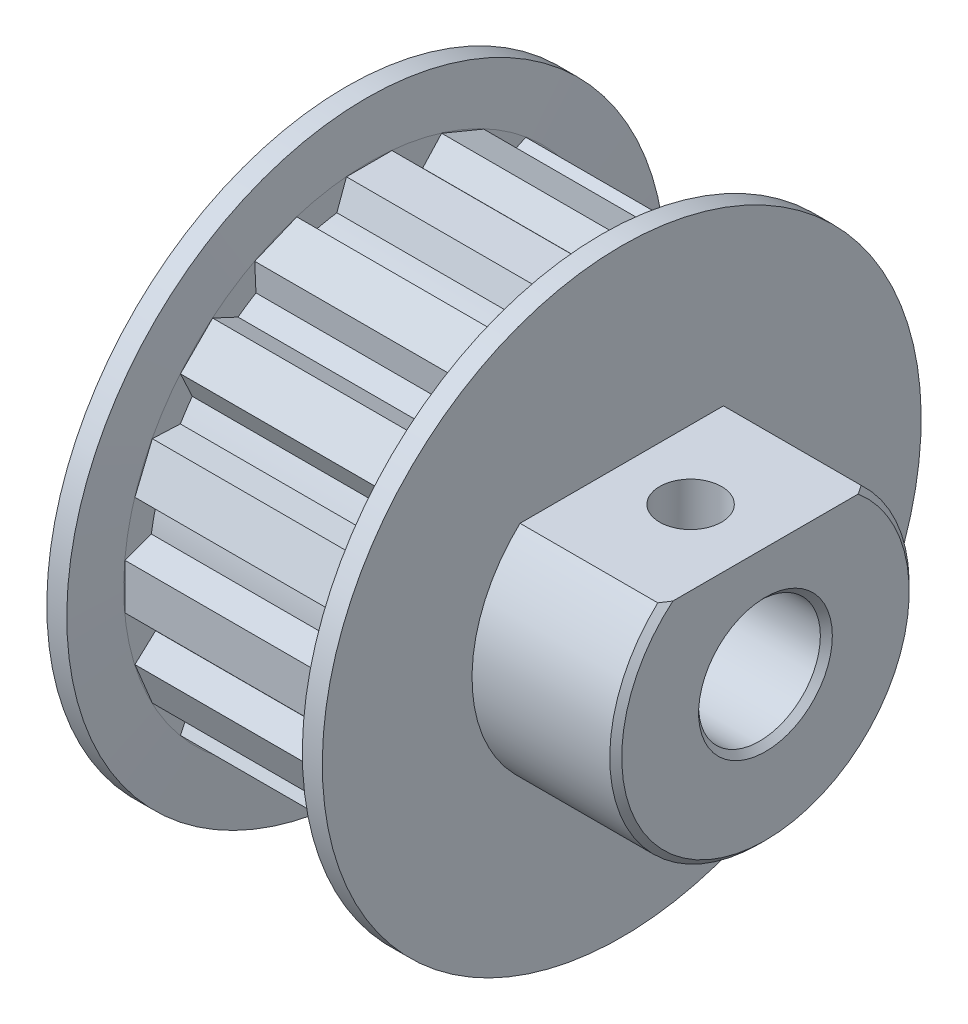
from build123d import *

# Parameters (mm, degrees)
SKETCH2_R                = 7.5
BOSS_EXTRUDE1_DEPTH      = 7.2
F_6_0_6_DIAMETER_HOLE1_D = 6.1
RIB1_REACH               = 31.85
SKETCH5_WALL_W           = 73.199246226
SKETCH5_WALL_H           = 2.28033022
RIB1_DRAFT_ANGLE         = 20
RIB2_REACH               = 31.85
SKETCH6_WALL_W           = 73.199246226
SKETCH6_WALL_H           = 2.28033022
RIB2_DRAFT_ANGLE         = 20
RIB3_REACH               = 31.85
SKETCH7_WALL_W           = 73.199246226
SKETCH7_WALL_H           = 2.28033022
RIB3_DRAFT_ANGLE         = 20
RIB4_REACH               = 31.85
SKETCH8_WALL_W           = 73.199246226
SKETCH8_WALL_H           = 2.28033022
RIB4_DRAFT_ANGLE         = 20
RIB5_REACH               = 31.85
SKETCH9_WALL_W           = 73.199246226
SKETCH9_WALL_H           = 2.28033022
RIB5_DRAFT_ANGLE         = 20
RIB6_REACH               = 31.85
SKETCH10_WALL_W          = 73.199246226
SKETCH10_WALL_H          = 2.28033022
RIB6_DRAFT_ANGLE         = 20
RIB7_REACH               = 31.85
SKETCH11_WALL_W          = 73.199246226
SKETCH11_WALL_H          = 2.28033022
RIB7_DRAFT_ANGLE         = 20
RIB8_REACH               = 31.85
SKETCH12_WALL_W          = 73.199246226
SKETCH12_WALL_H          = 2.28033022
RIB8_DRAFT_ANGLE         = 20
RIB9_REACH               = 31.85
SKETCH13_WALL_W          = 73.199246226
SKETCH13_WALL_H          = 2.28033022
RIB9_DRAFT_ANGLE         = 20
RIB10_REACH              = 31.85
SKETCH14_WALL_W          = 73.199246226
SKETCH14_WALL_H          = 2.28033022
RIB10_DRAFT_ANGLE        = 20
RIB11_REACH              = 31.85
SKETCH15_WALL_W          = 73.199246226
SKETCH15_WALL_H          = 2.28033022
RIB11_DRAFT_ANGLE        = 20
RIB12_REACH              = 31.85
SKETCH16_WALL_W          = 73.199246226
SKETCH16_WALL_H          = 2.28033022
RIB12_DRAFT_ANGLE        = 20
RIB13_REACH              = 31.85
SKETCH17_WALL_W          = 73.199246226
SKETCH17_WALL_H          = 2.28033022
RIB13_DRAFT_ANGLE        = 20
RIB14_REACH              = 31.85
SKETCH18_WALL_W          = 73.199246226
SKETCH18_WALL_H          = 2.28033022
RIB14_DRAFT_ANGLE        = 20
RIB15_REACH              = 31.85
SKETCH19_WALL_W          = 73.199246226
SKETCH19_WALL_H          = 2.28033022
RIB15_DRAFT_ANGLE        = 20
RIB16_REACH              = 31.85
SKETCH20_WALL_W          = 73.199246226
SKETCH20_WALL_H          = 2.28033022
RIB16_DRAFT_ANGLE        = 20
CHAMFER1_SIZE            = 0.3
SKETCH21_W               = 10.190038524
SKETCH21_H               = 2.367326759
CUT_EXTRUDE1_DEPTH       = 7.2
SKETCH22_R               = 1.55
CUT_EXTRUDE2_DEPTH       = 5.2


with BuildPart() as part:
    # Sketch1 → Revolve1 (revolve)
    with BuildSketch(Plane.XY):
        Polygon((0, 15), (0, 0), (13.8, 0), (13.8, 15), (12.8, 15), (12.65, 12.3), (12.65, 11.032395447), (1.15, 11.032395447), (1.15, 12.3), (1, 15), align=None)
    revolve(axis=Axis((0, 0, 0), (1, 0, 0)))

    # Sketch2 → Boss-Extrude1 (add)
    with BuildSketch(Plane(origin=(13.8, 0, 0), x_dir=(0, 0, -1), z_dir=(1, 0, 0))):
        Circle(SKETCH2_R)
    extrude(amount=BOSS_EXTRUDE1_DEPTH)

    # Ø6.0 (6) Diameter Hole1 (through all)
    with Locations(Plane(origin=(21, 0, 0), x_dir=(0, 0, -1), z_dir=(1, 0, 0))):
        with Locations((0, 0)):
            Hole(F_6_0_6_DIAMETER_HOLE1_D / 2)

    # Sketch5 wall → Rib1 (add, up to next)
    with BuildSketch(Plane(origin=(6.9, 0, 12.232395447), x_dir=(-1, 0, 0), z_dir=(0, 0, -1)), mode=Mode.PRIVATE) as rib1_sk1:
        Rectangle(SKETCH5_WALL_W, SKETCH5_WALL_H)
    rib1_tool1 = extrude(rib1_sk1.sketch, amount=RIB1_REACH, mode=Mode.PRIVATE) - part.part
    add(rib1_tool1.solids().sort_by_distance((6.9, 0, 12.232395447))[0])

    # Rib1 draft
    rib1_draft_faces = [part.faces().sort_by_distance(p)[0] for p in [
        (6.9, 1.14016511, 11.732395447),
        (6.9, -1.14016511, 11.732395447),
    ]]
    draft(rib1_draft_faces, Plane(origin=(6.9, 0, 12.232395447), x_dir=(-1, 0, 0), z_dir=(0, 0, 1)), RIB1_DRAFT_ANGLE)

    # Sketch6 wall → Rib2 (add, up to next)
    with BuildSketch(Plane(origin=(6.9, -12.232395447, 0), x_dir=(-1, 0, 0), z_dir=(0, 1, 0)), mode=Mode.PRIVATE) as rib2_sk1:
        Rectangle(SKETCH6_WALL_W, SKETCH6_WALL_H)
    rib2_tool1 = extrude(rib2_sk1.sketch, amount=RIB2_REACH, mode=Mode.PRIVATE) - part.part
    add(rib2_tool1.solids().sort_by_distance((6.9, -12.232395447, 0))[0])

    # Rib2 draft
    rib2_draft_faces = [part.faces().sort_by_distance(p)[0] for p in [
        (6.9, -11.732395447, 1.14016511),
        (6.9, -11.732395447, -1.14016511),
    ]]
    draft(rib2_draft_faces, Plane(origin=(6.9, -12.232395447, 0), x_dir=(-1, 0, 0), z_dir=(0, -1, 0)), RIB2_DRAFT_ANGLE)

    # Sketch7 wall → Rib3 (add, up to next)
    with BuildSketch(Plane(origin=(6.9, 0, -12.232395447), x_dir=(-1, 0, 0), z_dir=(0, 0, 1)), mode=Mode.PRIVATE) as rib3_sk1:
        Rectangle(SKETCH7_WALL_W, SKETCH7_WALL_H)
    rib3_tool1 = extrude(rib3_sk1.sketch, amount=RIB3_REACH, mode=Mode.PRIVATE) - part.part
    add(rib3_tool1.solids().sort_by_distance((6.9, 0, -12.232395447))[0])

    # Rib3 draft
    rib3_draft_faces = [part.faces().sort_by_distance(p)[0] for p in [
        (6.9, -1.14016511, -11.732395447),
        (6.9, 1.14016511, -11.732395447),
    ]]
    draft(rib3_draft_faces, Plane(origin=(6.9, 0, -12.232395447), x_dir=(-1, 0, 0), z_dir=(0, 0, -1)), RIB3_DRAFT_ANGLE)

    # Sketch8 wall → Rib4 (add, up to next)
    with BuildSketch(Plane(origin=(6.9, 12.232395447, 0), x_dir=(-1, 0, 0), z_dir=(0, -1, 0)), mode=Mode.PRIVATE) as rib4_sk1:
        Rectangle(SKETCH8_WALL_W, SKETCH8_WALL_H)
    rib4_tool1 = extrude(rib4_sk1.sketch, amount=RIB4_REACH, mode=Mode.PRIVATE) - part.part
    add(rib4_tool1.solids().sort_by_distance((6.9, 12.232395447, 0))[0])

    # Rib4 draft
    rib4_draft_faces = [part.faces().sort_by_distance(p)[0] for p in [
        (6.9, 11.732395447, -1.14016511),
        (6.9, 11.732395447, 1.14016511),
    ]]
    draft(rib4_draft_faces, Plane(origin=(6.9, 12.232395447, 0), x_dir=(-1, 0, 0), z_dir=(0, 1, 0)), RIB4_DRAFT_ANGLE)

    # Sketch9 wall → Rib5 (add, up to next)
    with BuildSketch(Plane(origin=(6.9, -4.681135076, 11.301259787), x_dir=(-1, 0, 0), z_dir=(0, 0.382683432365, -0.923879532511)), mode=Mode.PRIVATE) as rib5_sk1:
        Rectangle(SKETCH9_WALL_W, SKETCH9_WALL_H)
    rib5_tool1 = extrude(rib5_sk1.sketch, amount=RIB5_REACH, mode=Mode.PRIVATE) - part.part
    add(rib5_tool1.solids().sort_by_distance((6.9, -4.681135076, 11.301259787))[0])

    # Rib5 draft
    rib5_draft_faces = [part.faces().sort_by_distance(p)[0] for p in [
        (6.9, -3.436418151, 11.275642318),
        (6.9, -5.543168569, 10.402997723),
    ]]
    draft(rib5_draft_faces, Plane(origin=(6.9, -4.681135076, 11.301259787), x_dir=(-1, 0, 0), z_dir=(0, -0.382683432365, 0.923879532511)), RIB5_DRAFT_ANGLE)

    # Sketch10 wall → Rib6 (add, up to next)
    with BuildSketch(Plane(origin=(6.9, -4.681135076, -11.301259787), x_dir=(-1, 0, 0), z_dir=(0, 0.382683432365, 0.923879532511)), mode=Mode.PRIVATE) as rib6_sk1:
        Rectangle(SKETCH10_WALL_W, SKETCH10_WALL_H)
    rib6_tool1 = extrude(rib6_sk1.sketch, amount=RIB6_REACH, mode=Mode.PRIVATE) - part.part
    add(rib6_tool1.solids().sort_by_distance((6.9, -4.681135076, -11.301259787))[0])

    # Rib6 draft
    rib6_draft_faces = [part.faces().sort_by_distance(p)[0] for p in [
        (6.9, -5.543168569, -10.402997723),
        (6.9, -3.436418151, -11.275642318),
    ]]
    draft(rib6_draft_faces, Plane(origin=(6.9, -4.681135076, -11.301259787), x_dir=(-1, 0, 0), z_dir=(0, -0.382683432365, -0.923879532511)), RIB6_DRAFT_ANGLE)

    # Sketch11 wall → Rib7 (add, up to next)
    with BuildSketch(Plane(origin=(6.9, -11.301259787, 4.681135076), x_dir=(-1, 0, 0), z_dir=(0, 0.923879532511, -0.382683432365)), mode=Mode.PRIVATE) as rib7_sk1:
        Rectangle(SKETCH11_WALL_W, SKETCH11_WALL_H)
    rib7_tool1 = extrude(rib7_sk1.sketch, amount=RIB7_REACH, mode=Mode.PRIVATE) - part.part
    add(rib7_tool1.solids().sort_by_distance((6.9, -11.301259787, 4.681135076))[0])

    # Rib7 draft
    rib7_draft_faces = [part.faces().sort_by_distance(p)[0] for p in [
        (6.9, -10.402997723, 5.543168569),
        (6.9, -11.275642318, 3.436418151),
    ]]
    draft(rib7_draft_faces, Plane(origin=(6.9, -11.301259787, 4.681135076), x_dir=(-1, 0, 0), z_dir=(0, -0.923879532511, 0.382683432365)), RIB7_DRAFT_ANGLE)

    # Sketch12 wall → Rib8 (add, up to next)
    with BuildSketch(Plane(origin=(6.9, -8.649609771, -8.649609771), x_dir=(-1, 0, 0), z_dir=(0, 0.707106781187, 0.707106781187)), mode=Mode.PRIVATE) as rib8_sk1:
        Rectangle(SKETCH12_WALL_W, SKETCH12_WALL_H)
    rib8_tool1 = extrude(rib8_sk1.sketch, amount=RIB8_REACH, mode=Mode.PRIVATE) - part.part
    add(rib8_tool1.solids().sort_by_distance((6.9, -8.649609771, -8.649609771))[0])

    # Rib8 draft
    rib8_draft_faces = [part.faces().sort_by_distance(p)[0] for p in [
        (6.9, -9.102274861, -7.4898379),
        (6.9, -7.4898379, -9.102274861),
    ]]
    draft(rib8_draft_faces, Plane(origin=(6.9, -8.649609771, -8.649609771), x_dir=(-1, 0, 0), z_dir=(0, -0.707106781187, -0.707106781187)), RIB8_DRAFT_ANGLE)

    # Sketch13 wall → Rib9 (add, up to next)
    with BuildSketch(Plane(origin=(6.9, 8.649609771, 8.649609771), x_dir=(-1, 0, 0), z_dir=(0, -0.707106781187, -0.707106781187)), mode=Mode.PRIVATE) as rib9_sk1:
        Rectangle(SKETCH13_WALL_W, SKETCH13_WALL_H)
    rib9_tool1 = extrude(rib9_sk1.sketch, amount=RIB9_REACH, mode=Mode.PRIVATE) - part.part
    add(rib9_tool1.solids().sort_by_distance((6.9, 8.649609771, 8.649609771))[0])

    # Rib9 draft
    rib9_draft_faces = [part.faces().sort_by_distance(p)[0] for p in [
        (6.9, 9.102274861, 7.4898379),
        (6.9, 7.4898379, 9.102274861),
    ]]
    draft(rib9_draft_faces, Plane(origin=(6.9, 8.649609771, 8.649609771), x_dir=(-1, 0, 0), z_dir=(0, 0.707106781187, 0.707106781187)), RIB9_DRAFT_ANGLE)

    # Sketch14 wall → Rib10 (add, up to next)
    with BuildSketch(Plane(origin=(6.9, -11.301259787, -4.681135076), x_dir=(-1, 0, 0), z_dir=(0, 0.923879532511, 0.382683432365)), mode=Mode.PRIVATE) as rib10_sk1:
        Rectangle(SKETCH14_WALL_W, SKETCH14_WALL_H)
    rib10_tool1 = extrude(rib10_sk1.sketch, amount=RIB10_REACH, mode=Mode.PRIVATE) - part.part
    add(rib10_tool1.solids().sort_by_distance((6.9, -11.301259787, -4.681135076))[0])

    # Rib10 draft
    rib10_draft_faces = [part.faces().sort_by_distance(p)[0] for p in [
        (6.9, -11.275642318, -3.436418151),
        (6.9, -10.402997723, -5.543168569),
    ]]
    draft(rib10_draft_faces, Plane(origin=(6.9, -11.301259787, -4.681135076), x_dir=(-1, 0, 0), z_dir=(0, -0.923879532511, -0.382683432365)), RIB10_DRAFT_ANGLE)

    # Sketch15 wall → Rib11 (add, up to next)
    with BuildSketch(Plane(origin=(6.9, -8.649609771, 8.649609771), x_dir=(-1, 0, 0), z_dir=(0, 0.707106781187, -0.707106781187)), mode=Mode.PRIVATE) as rib11_sk1:
        Rectangle(SKETCH15_WALL_W, SKETCH15_WALL_H)
    rib11_tool1 = extrude(rib11_sk1.sketch, amount=RIB11_REACH, mode=Mode.PRIVATE) - part.part
    add(rib11_tool1.solids().sort_by_distance((6.9, -8.649609771, 8.649609771))[0])

    # Rib11 draft
    rib11_draft_faces = [part.faces().sort_by_distance(p)[0] for p in [
        (6.9, -7.4898379, 9.102274861),
        (6.9, -9.102274861, 7.4898379),
    ]]
    draft(rib11_draft_faces, Plane(origin=(6.9, -8.649609771, 8.649609771), x_dir=(-1, 0, 0), z_dir=(0, -0.707106781187, 0.707106781187)), RIB11_DRAFT_ANGLE)

    # Sketch16 wall → Rib12 (add, up to next)
    with BuildSketch(Plane(origin=(6.9, 8.649609771, -8.649609771), x_dir=(-1, 0, 0), z_dir=(0, -0.707106781187, 0.707106781187)), mode=Mode.PRIVATE) as rib12_sk1:
        Rectangle(SKETCH16_WALL_W, SKETCH16_WALL_H)
    rib12_tool1 = extrude(rib12_sk1.sketch, amount=RIB12_REACH, mode=Mode.PRIVATE) - part.part
    add(rib12_tool1.solids().sort_by_distance((6.9, 8.649609771, -8.649609771))[0])

    # Rib12 draft
    rib12_draft_faces = [part.faces().sort_by_distance(p)[0] for p in [
        (6.9, 7.4898379, -9.102274861),
        (6.9, 9.102274861, -7.4898379),
    ]]
    draft(rib12_draft_faces, Plane(origin=(6.9, 8.649609771, -8.649609771), x_dir=(-1, 0, 0), z_dir=(0, 0.707106781187, -0.707106781187)), RIB12_DRAFT_ANGLE)

    # Sketch17 wall → Rib13 (add, up to next)
    with BuildSketch(Plane(origin=(6.9, 4.681135076, -11.301259787), x_dir=(-1, 0, 0), z_dir=(0, -0.382683432365, 0.923879532511)), mode=Mode.PRIVATE) as rib13_sk1:
        Rectangle(SKETCH17_WALL_W, SKETCH17_WALL_H)
    rib13_tool1 = extrude(rib13_sk1.sketch, amount=RIB13_REACH, mode=Mode.PRIVATE) - part.part
    add(rib13_tool1.solids().sort_by_distance((6.9, 4.681135076, -11.301259787))[0])

    # Rib13 draft
    rib13_draft_faces = [part.faces().sort_by_distance(p)[0] for p in [
        (6.9, 3.436418151, -11.275642318),
        (6.9, 5.543168569, -10.402997723),
    ]]
    draft(rib13_draft_faces, Plane(origin=(6.9, 4.681135076, -11.301259787), x_dir=(-1, 0, 0), z_dir=(0, 0.382683432365, -0.923879532511)), RIB13_DRAFT_ANGLE)

    # Sketch18 wall → Rib14 (add, up to next)
    with BuildSketch(Plane(origin=(6.9, 11.301259787, 4.681135076), x_dir=(-1, 0, 0), z_dir=(0, -0.923879532511, -0.382683432365)), mode=Mode.PRIVATE) as rib14_sk1:
        Rectangle(SKETCH18_WALL_W, SKETCH18_WALL_H)
    rib14_tool1 = extrude(rib14_sk1.sketch, amount=RIB14_REACH, mode=Mode.PRIVATE) - part.part
    add(rib14_tool1.solids().sort_by_distance((6.9, 11.301259787, 4.681135076))[0])

    # Rib14 draft
    rib14_draft_faces = [part.faces().sort_by_distance(p)[0] for p in [
        (6.9, 11.275642318, 3.436418151),
        (6.9, 10.402997723, 5.543168569),
    ]]
    draft(rib14_draft_faces, Plane(origin=(6.9, 11.301259787, 4.681135076), x_dir=(-1, 0, 0), z_dir=(0, 0.923879532511, 0.382683432365)), RIB14_DRAFT_ANGLE)

    # Sketch19 wall → Rib15 (add, up to next)
    with BuildSketch(Plane(origin=(6.9, 11.301259787, -4.681135076), x_dir=(-1, 0, 0), z_dir=(0, -0.923879532511, 0.382683432365)), mode=Mode.PRIVATE) as rib15_sk1:
        Rectangle(SKETCH19_WALL_W, SKETCH19_WALL_H)
    rib15_tool1 = extrude(rib15_sk1.sketch, amount=RIB15_REACH, mode=Mode.PRIVATE) - part.part
    add(rib15_tool1.solids().sort_by_distance((6.9, 11.301259787, -4.681135076))[0])

    # Rib15 draft
    rib15_draft_faces = [part.faces().sort_by_distance(p)[0] for p in [
        (6.9, 10.402997723, -5.543168569),
        (6.9, 11.275642318, -3.436418151),
    ]]
    draft(rib15_draft_faces, Plane(origin=(6.9, 11.301259787, -4.681135076), x_dir=(-1, 0, 0), z_dir=(0, 0.923879532511, -0.382683432365)), RIB15_DRAFT_ANGLE)

    # Sketch20 wall → Rib16 (add, up to next)
    with BuildSketch(Plane(origin=(6.9, 4.681135076, 11.301259787), x_dir=(-1, 0, 0), z_dir=(0, -0.382683432365, -0.923879532511)), mode=Mode.PRIVATE) as rib16_sk1:
        Rectangle(SKETCH20_WALL_W, SKETCH20_WALL_H)
    rib16_tool1 = extrude(rib16_sk1.sketch, amount=RIB16_REACH, mode=Mode.PRIVATE) - part.part
    add(rib16_tool1.solids().sort_by_distance((6.9, 4.681135076, 11.301259787))[0])

    # Rib16 draft
    rib16_draft_faces = [part.faces().sort_by_distance(p)[0] for p in [
        (6.9, 5.543168569, 10.402997723),
        (6.9, 3.436418151, 11.275642318),
    ]]
    draft(rib16_draft_faces, Plane(origin=(6.9, 4.681135076, 11.301259787), x_dir=(-1, 0, 0), z_dir=(0, 0.382683432365, 0.923879532511)), RIB16_DRAFT_ANGLE)

    # Chamfer1
    chamfer1_edges = [part.edges().sort_by_distance(p)[0] for p in [
        (21, 0, 7.5),
        (0, 0, -3.05),
        (21, 0, -3.05),
    ]]
    chamfer(chamfer1_edges, length=CHAMFER1_SIZE)

    # Sketch21 → Cut-Extrude1 (cut)
    with BuildSketch(Plane(origin=(21, 0, 0), x_dir=(0, 0, -1), z_dir=(1, 0, 0))):
        with Locations((0, 6.687369288)):
            Rectangle(SKETCH21_W, SKETCH21_H)
    extrude(amount=-CUT_EXTRUDE1_DEPTH, mode=Mode.SUBTRACT)

    # Sketch22 → Cut-Extrude2 (cut)
    with BuildSketch(Plane(origin=(0, 5.503705908, 0), x_dir=(1, 0, 0), z_dir=(0, 1, 0))):
        with Locations((17.25, 0)):
            Circle(SKETCH22_R)
    extrude(amount=-CUT_EXTRUDE2_DEPTH, mode=Mode.SUBTRACT)


solid = part.part
